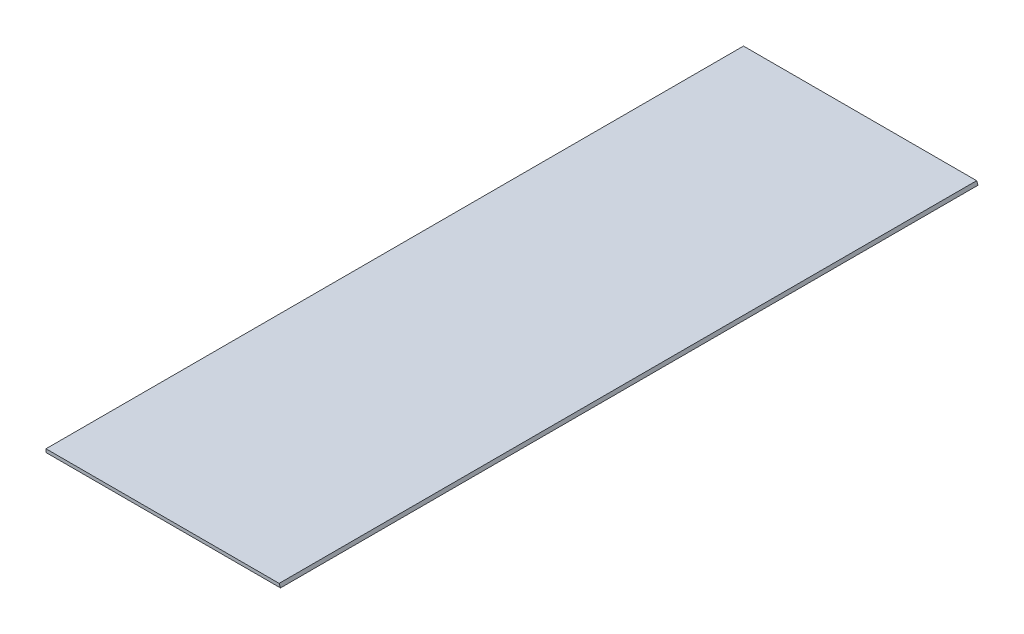
from build123d import *

# Parameters (mm, degrees)
BOSS_EXTRUDE1_DEPTH = 501.65


with BuildPart() as part:
    # Sketch1 → Boss-Extrude1 (new body)
    with BuildSketch(Plane.XY):
        Polygon((0, 0), (0, 2.3622), (167.677544723, 2.3622), (168.656, 0), align=None)
    extrude(amount=BOSS_EXTRUDE1_DEPTH)


solid = part.part
